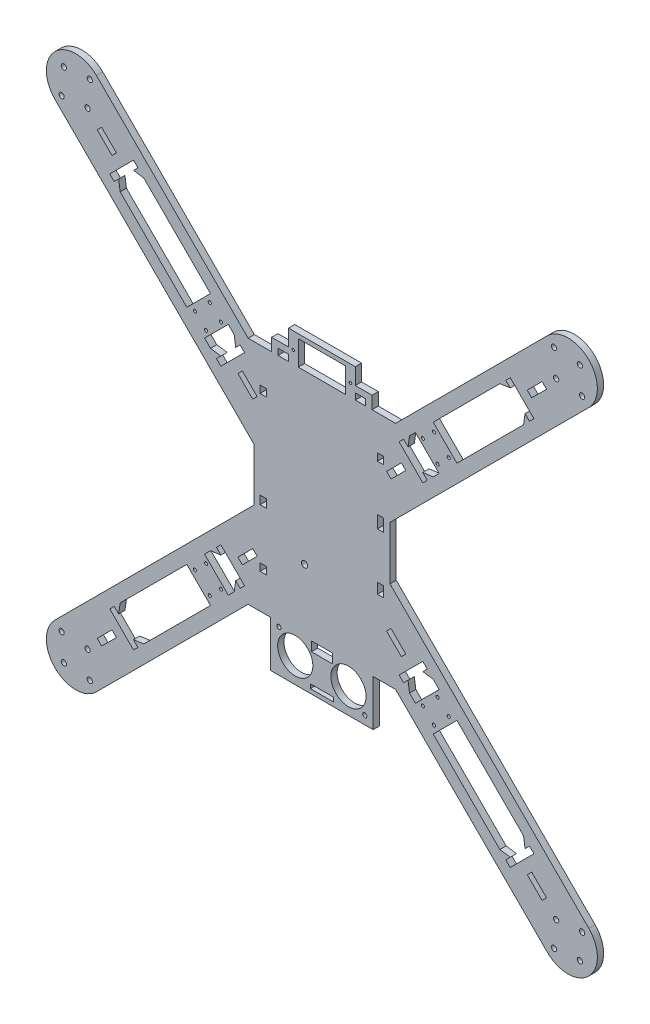
from build123d import *

# Parameters (mm, degrees)
BOSS_EXTRUDE1_DEPTH = 3
SKETCH4_R           = 1.25
CUT_EXTRUDE1_DEPTH  = 4.5
SKETCH5_R           = 0.65
SKETCH5_W           = 22.5
SKETCH5_H           = 11.8
CUT_EXTRUDE2_DEPTH  = 4.5
SKETCH6_R           = 1.5
CUT_EXTRUDE3_DEPTH  = 4.5
SKETCH7_R           = 1
SKETCH7_R_2         = 8.4
SKETCH7_W           = 10
SKETCH7_H           = 4.5
SKETCH7_W_2         = 11
SKETCH7_H_2         = 2
CUT_EXTRUDE4_DEPTH  = 4.5
CUT_EXTRUDE5_DEPTH  = 186.993279448
BOSS_EXTRUDE2_REACH = 195.992
SKETCH9_W           = 3
SKETCH9_H           = 12
BOSS_EXTRUDE3_REACH = 195.992
SKETCH11_W          = 3
SKETCH11_H          = 12
BOSS_EXTRUDE4_REACH = 195.992
SKETCH12_W          = 3
SKETCH12_H          = 12
BOSS_EXTRUDE5_REACH = 195.992
SKETCH13_W          = 3
SKETCH13_H          = 12
SKETCH14_W          = 3
SKETCH14_H          = 6
SKETCH14_H_2        = 3.5
SKETCH14_H_3        = 4
SKETCH14_H_4        = 5
CUT_EXTRUDE6_DEPTH  = 186.993279448
SKETCH15_R          = 0.75
CUT_EXTRUDE7_DEPTH  = 186.993279448
SKETCH17_W          = 8
SKETCH17_H          = 6
BOSS_EXTRUDE8_DEPTH = 3
SKETCH19_W          = 5
SKETCH19_H          = 3
CUT_EXTRUDE9_DEPTH  = 186.993279448


with BuildPart() as part:
    # Sketch1 → Boss-Extrude1 (new body)
    with BuildSketch(Plane.XY):
        with BuildLine():
            Line((35.201010127, 55), (15.95, 55))
            Line((15.95, 55), (15.95, 68.8))
            Line((15.95, 68.8), (-15.95, 68.8))
            Line((-15.95, 68.8), (-15.95, 55))
            Line((-15.95, 55), (-35.201010127, 55))
            Line((-35.201010127, 55), (-107.600505063, 127.399494937))
            ThreePointArc((-107.600505063, 127.399494937), (-127.399494937, 127.399494937), (-127.399494937, 107.600505063))
            Line((-127.399494937, 107.600505063), (-32.5, 12.701010127))
            Line((-32.5, 12.701010127), (-32.5, -12.701010127))
            Line((-32.5, -12.701010127), (-127.399494937, -107.600505063))
            ThreePointArc((-127.399494937, -107.600505063), (-127.399494937, -127.399494937), (-107.600505063, -127.399494937))
            Line((-107.600505063, -127.399494937), (-35.201010127, -55))
            Line((-35.201010127, -55), (-24.5, -55))
            Line((-24.5, -55), (-24.5, -77))
            Line((-24.5, -77), (24.5, -77))
            Line((24.5, -77), (24.5, -55))
            Line((24.5, -55), (35.201010127, -55))
            Line((35.201010127, -55), (107.600505063, -127.399494937))
            ThreePointArc((107.600505063, -127.399494937), (127.399494937, -127.399494937), (127.399494937, -107.600505063))
            Line((127.399494937, -107.600505063), (32.5, -12.701010127))
            Line((32.5, -12.701010127), (32.5, 12.701010127))
            Line((32.5, 12.701010127), (127.399494937, 107.600505063))
            ThreePointArc((127.399494937, 107.600505063), (127.399494937, 127.399494937), (107.600505063, 127.399494937))
            Line((107.600505063, 127.399494937), (35.201010127, 55))
        make_face()
    extrude(amount=-BOSS_EXTRUDE1_DEPTH)

    # Sketch4 → Cut-Extrude1 (cut)
    with BuildSketch(Plane.XY):
        with Locations((-110.782485579, 124.217514421)):
            Circle(SKETCH4_R)
        with Locations((-124.217514421, 110.782485579)):
            Circle(SKETCH4_R)
        with Locations((-123.156854249, 123.156854249)):
            Circle(SKETCH4_R)
        with Locations((-111.843145751, 111.843145751)):
            Circle(SKETCH4_R)
        with Locations((111.843145751, 111.843145751)):
            Circle(SKETCH4_R)
        with Locations((110.782485579, 124.217514421)):
            Circle(SKETCH4_R)
        with Locations((123.156854249, 123.15685425)):
            Circle(SKETCH4_R)
        with Locations((124.217514421, 110.782485579)):
            Circle(SKETCH4_R)
        with Locations((111.843145751, -111.84314575)):
            Circle(SKETCH4_R)
        with Locations((124.217514421, -110.782485579)):
            Circle(SKETCH4_R)
        with Locations((123.15685425, -123.156854249)):
            Circle(SKETCH4_R)
        with Locations((110.782485579, -124.217514421)):
            Circle(SKETCH4_R)
        with Locations((-111.84314575, -111.843145751)):
            Circle(SKETCH4_R)
        with Locations((-110.782485579, -124.217514421)):
            Circle(SKETCH4_R)
        with Locations((-123.156854249, -123.156854249)):
            Circle(SKETCH4_R)
        with Locations((-124.217514421, -110.782485579)):
            Circle(SKETCH4_R)
    extrude(amount=-CUT_EXTRUDE1_DEPTH, mode=Mode.SUBTRACT)

    # Sketch5 → Cut-Extrude2 (cut)
    with BuildSketch(Plane.XY):
        with Locations((-13.65, 60.9)):
            Circle(SKETCH5_R)
        with Locations((13.65, 60.9)):
            Circle(SKETCH5_R)
        with Locations((0, 60.9)):
            Rectangle(SKETCH5_W, SKETCH5_H)
    extrude(amount=-CUT_EXTRUDE2_DEPTH, mode=Mode.SUBTRACT)

    # Sketch6 → Cut-Extrude3 (cut)
    with BuildSketch(Plane.XY):
        with Locations((-8.25, -25)):
            Circle(SKETCH6_R)
    extrude(amount=-CUT_EXTRUDE3_DEPTH, mode=Mode.SUBTRACT)

    # Sketch7 → Cut-Extrude4 (cut)
    with BuildSketch(Plane.XY):
        with Locations((-20.5, -57)):
            Circle(SKETCH7_R)
        with Locations((-12.7, -65)):
            Circle(SKETCH7_R_2)
        with Locations((12.7, -65)):
            Circle(SKETCH7_R_2)
        with Locations((20.5, -73)):
            Circle(SKETCH7_R)
        with Locations((0, -57.25)):
            Rectangle(SKETCH7_W, SKETCH7_H)
        with Locations((0, -74)):
            Rectangle(SKETCH7_W_2, SKETCH7_H_2)
    extrude(amount=-CUT_EXTRUDE4_DEPTH, mode=Mode.SUBTRACT)

    # Sketch8 → Cut-Extrude5 (cut, through all)
    with BuildSketch(Plane.XY):
        Polygon((101.236544033, -89.922835534), (89.922835534, -101.236544033), (87.80151519, -99.115223689), (89.922835534, -96.993903346), (84.973088065, -96.286796564), (41.839574413, -53.153282912), (41.132467632, -48.203535444), (39.011147288, -50.324855787), (36.889826945, -48.203535444), (48.203535444, -36.889826945), (50.324855787, -39.011147288), (48.203535444, -41.132467632), (53.153282912, -41.839574413), (96.286796564, -84.973088065), (96.993903346, -89.922835534), (99.115223689, -87.80151519), align=None)
        Polygon((40.07180746, -37.950487117), (37.950487117, -40.07180746), (30.879419305, -33.000739648), (33.000739648, -30.879419305), align=None)
        Polygon((50.324855787, 39.011147288), (48.203535444, 36.889826945), (36.889826945, 48.203535444), (39.011147288, 50.324855787), (41.132467632, 48.203535444), (41.839574413, 53.153282912), (84.973088065, 96.286796564), (89.922835534, 96.993903346), (87.80151519, 99.115223689), (89.922835534, 101.236544033), (101.236544033, 89.922835534), (99.115223689, 87.80151519), (96.993903346, 89.922835534), (96.286796564, 84.973088065), (53.153282912, 41.839574413), (48.142875272, 41.193127804), align=None)
        Polygon((100.175883861, -98.054563517), (98.054563517, -100.175883861), (105.125631329, -107.246951673), (107.246951673, -105.125631329), align=None)
        Polygon((-101.236544033, -89.922835534), (-99.115223689, -87.80151519), (-96.993903346, -89.922835534), (-96.286796564, -84.973088065), (-53.153282912, -41.839574413), (-48.203535444, -41.132467632), (-50.324855787, -39.011147288), (-48.203535444, -36.889826945), (-36.889826945, -48.203535444), (-39.011147288, -50.324855787), (-41.132467632, -48.203535444), (-41.839574413, -53.153282912), (-84.973088065, -96.286796564), (-89.922835534, -96.993903346), (-87.80151519, -99.115223689), (-89.922835534, -101.236544033), align=None)
        Polygon((-100.175883861, -98.054563517), (-107.246951673, -105.125631329), (-105.125631329, -107.246951673), (-98.054563517, -100.175883861), align=None)
        Polygon((-37.950487117, -40.07180746), (-40.07180746, -37.950487117), (-33.000739648, -30.879419305), (-30.879419305, -33.000739648), align=None)
        Polygon((-89.922835534, 101.236544033), (-87.80151519, 99.115223689), (-89.922835534, 96.993903346), (-84.973088065, 96.286796564), (-41.839574413, 53.153282912), (-41.132467632, 48.203535444), (-39.011147288, 50.324855787), (-36.889826945, 48.203535444), (-48.203535444, 36.889826945), (-50.324855787, 39.011147288), (-48.203535444, 41.132467632), (-53.153282912, 41.839574413), (-96.286796564, 84.973088065), (-96.993903346, 89.922835534), (-99.115223689, 87.80151519), (-101.236544033, 89.922835534), align=None)
        Polygon((-98.054563517, 100.175883861), (-105.125631329, 107.246951673), (-107.246951673, 105.125631329), (-100.175883861, 98.054563517), align=None)
        Polygon((-40.07180746, 37.950487117), (-37.950487117, 40.07180746), (-30.879419305, 33.000739648), (-33.000739648, 30.879419305), align=None)
        Polygon((100.175883861, 98.054563517), (107.246951673, 105.125631329), (105.125631329, 107.246951673), (98.054563517, 100.175883861), align=None)
        Polygon((37.950487117, 40.07180746), (40.07180746, 37.950487117), (33.000739648, 30.879419305), (30.879419305, 33.000739648), align=None)
    extrude(amount=-CUT_EXTRUDE5_DEPTH, mode=Mode.SUBTRACT)

    # Sketch9 → Boss-Extrude2 (add, up to next)
    with BuildSketch(Plane(origin=(-5.656854249, 5.656854249, 0), x_dir=(0, 0, -1), z_dir=(0.70710678118654, -0.707106781186555, 0)), mode=Mode.PRIVATE) as boss_extrude2_sk1:
        with Locations((1.5, 77.170093579)):
            Rectangle(SKETCH9_W, SKETCH9_H)
    boss_extrude2_tool1 = extrude(boss_extrude2_sk1.sketch, amount=BOSS_EXTRUDE2_REACH, mode=Mode.PRIVATE) - part.part
    add(boss_extrude2_tool1.solids().sort_by_distance((48.910642, 60.224351, -1.5))[0])

    # Sketch11 → Boss-Extrude3 (add, up to next)
    with BuildSketch(Plane(origin=(5.656854249, 5.656854249, 0), x_dir=(0, 0, 1), z_dir=(-0.7071067811865477, -0.7071067811865475, 0)), mode=Mode.PRIVATE) as boss_extrude3_sk1:
        with Locations((-1.5, -77.170093579)):
            Rectangle(SKETCH11_W, SKETCH11_H)
    boss_extrude3_tool1 = extrude(boss_extrude3_sk1.sketch, amount=BOSS_EXTRUDE3_REACH, mode=Mode.PRIVATE) - part.part
    add(boss_extrude3_tool1.solids().sort_by_distance((60.224351, -48.910642, -1.5))[0])

    # Sketch12 → Boss-Extrude4 (add, up to next)
    with BuildSketch(Plane(origin=(5.656854249, -5.656854249, 0), x_dir=(0, 0, 1), z_dir=(-0.7071067811865449, 0.7071067811865502, 0)), mode=Mode.PRIVATE) as boss_extrude4_sk1:
        with Locations((-1.5, -77.170093579)):
            Rectangle(SKETCH12_W, SKETCH12_H)
    boss_extrude4_tool1 = extrude(boss_extrude4_sk1.sketch, amount=BOSS_EXTRUDE4_REACH, mode=Mode.PRIVATE) - part.part
    add(boss_extrude4_tool1.solids().sort_by_distance((-48.910642, -60.224351, -1.5))[0])

    # Sketch13 → Boss-Extrude5 (add, up to next)
    with BuildSketch(Plane(origin=(5.656854249, 5.656854249, 0), x_dir=(0, 0, 1), z_dir=(-0.707106781186552, -0.707106781186543, 0)), mode=Mode.PRIVATE) as boss_extrude5_sk1:
        with Locations((-1.5, 77.170093579)):
            Rectangle(SKETCH13_W, SKETCH13_H)
    boss_extrude5_tool1 = extrude(boss_extrude5_sk1.sketch, amount=BOSS_EXTRUDE5_REACH, mode=Mode.PRIVATE) - part.part
    add(boss_extrude5_tool1.solids().sort_by_distance((-48.910642, 60.224351, -1.5))[0])

    # Sketch14 → Cut-Extrude6 (cut, through all)
    with BuildSketch(Plane(origin=(0, 0, -3), x_dir=(-1, 0, 0), z_dir=(0, 0, -1))):
        with Locations((-28, 10)):
            Rectangle(SKETCH14_W, SKETCH14_H)
        with Locations((28, -36.75)):
            Rectangle(SKETCH14_W, SKETCH14_H_2)
        with Locations((28, -9)):
            Rectangle(SKETCH14_W, SKETCH14_H_3)
        with Locations((28, 36.75)):
            Rectangle(SKETCH14_W, SKETCH14_H_2)
        with Locations((-28, -17.5)):
            Rectangle(SKETCH14_W, SKETCH14_H_4)
        with Locations((-28, 36.75)):
            Rectangle(SKETCH14_W, SKETCH14_H_2)
    extrude(amount=-CUT_EXTRUDE6_DEPTH, mode=Mode.SUBTRACT)

    # Sketch15 → Cut-Extrude7 (cut, through all)
    with BuildSketch(Plane(origin=(0, 0, -3), x_dir=(-1, 0, 0), z_dir=(0, 0, -1))):
        with Locations((-60.577904114, -53.506836303)):
            Circle(SKETCH15_R)
        with Locations((-55.274603256, -48.203535444)):
            Circle(SKETCH15_R)
        with Locations((-48.203535444, -55.274603256)):
            Circle(SKETCH15_R)
        with Locations((-53.506836303, -60.577904114)):
            Circle(SKETCH15_R)
        with Locations((-53.506836303, 60.577904114)):
            Circle(SKETCH15_R)
        with Locations((-48.203535444, 55.274603256)):
            Circle(SKETCH15_R)
        with Locations((-60.577904114, 53.506836303)):
            Circle(SKETCH15_R)
        with Locations((-55.274603256, 48.203535444)):
            Circle(SKETCH15_R)
        with Locations((60.577904114, 53.506836303)):
            Circle(SKETCH15_R)
        with Locations((55.274603256, 48.203535444)):
            Circle(SKETCH15_R)
        with Locations((53.506836303, 60.577904114)):
            Circle(SKETCH15_R)
        with Locations((48.203535444, 55.274603256)):
            Circle(SKETCH15_R)
        with Locations((53.506836303, -60.577904114)):
            Circle(SKETCH15_R)
        with Locations((48.203535444, -55.274603256)):
            Circle(SKETCH15_R)
        with Locations((60.577904114, -53.506836303)):
            Circle(SKETCH15_R)
        with Locations((55.274603256, -48.203535444)):
            Circle(SKETCH15_R)
    extrude(amount=-CUT_EXTRUDE7_DEPTH, mode=Mode.SUBTRACT)

    # Sketch17 → Boss-Extrude8 (add)
    with BuildSketch(Plane(origin=(0, 0, -3), x_dir=(-1, 0, 0), z_dir=(0, 0, -1))):
        with Locations((19.95, 58)):
            Rectangle(SKETCH17_W, SKETCH17_H)
        with Locations((-19.95, 58)):
            Rectangle(SKETCH17_W, SKETCH17_H)
    extrude(amount=-BOSS_EXTRUDE8_DEPTH)

    # Sketch19 → Cut-Extrude9 (cut, through all)
    with BuildSketch(Plane(origin=(0, 0, -3), x_dir=(-1, 0, 0), z_dir=(0, 0, -1))):
        with Locations((18.45, 56.5)):
            Rectangle(SKETCH19_W, SKETCH19_H)
        with Locations((-18.45, 56.5)):
            Rectangle(SKETCH19_W, SKETCH19_H)
    extrude(amount=-CUT_EXTRUDE9_DEPTH, mode=Mode.SUBTRACT)


solid = part.part
